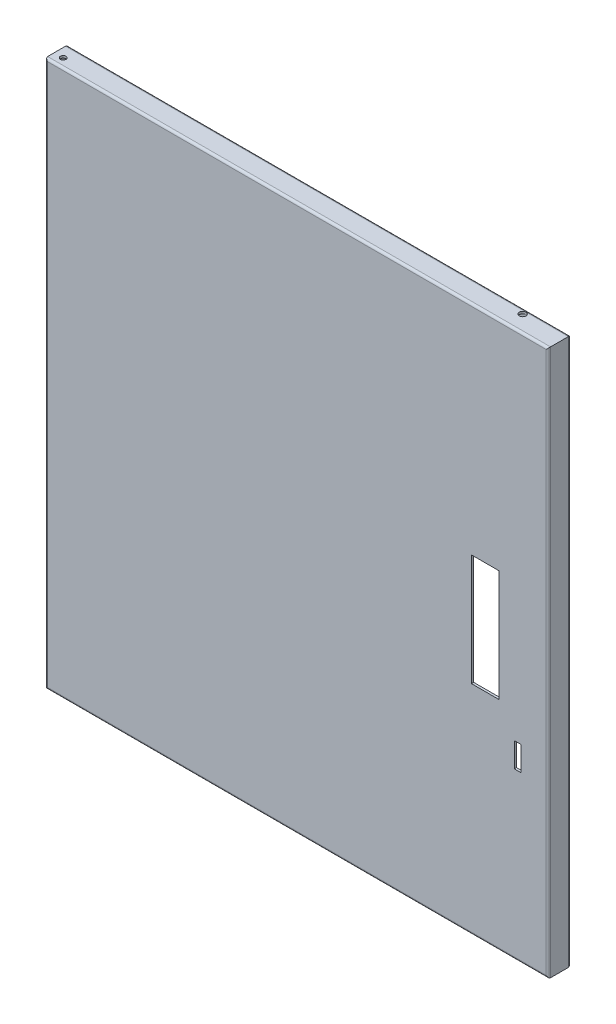
from build123d import *

# Parameters (mm, degrees)
SKETCH1_W           = 451
SKETCH1_H           = 490
BOSS_EXTRUDE1_DEPTH = 20
SKETCH2_W           = 429
SKETCH2_H           = 468
CUT_EXTRUDE1_DEPTH  = 18
SKETCH3_W           = 16
SKETCH3_H           = 468
CUT_EXTRUDE2_DEPTH  = 9
SKETCH4_W           = 438
SKETCH4_H           = 16
CUT_EXTRUDE3_DEPTH  = 9
SKETCH5_W           = 16
SKETCH5_H           = 477
CUT_EXTRUDE4_DEPTH  = 9
SKETCH6_W           = 447
SKETCH6_H           = 16
CUT_EXTRUDE5_DEPTH  = 9
FILLET3_R           = 2
FILLET4_R           = 2
SKETCH20_R          = 2.5
CUT_EXTRUDE12_DEPTH = 540.768700463
SKETCH21_R          = 3
CUT_EXTRUDE13_DEPTH = 2
SKETCH22_R          = 3
CUT_EXTRUDE14_DEPTH = 2
SKETCH23_W          = 25
SKETCH23_H          = 100
SKETCH23_W_2        = 6
SKETCH23_H_2        = 22
CUT_EXTRUDE15_DEPTH = 2


with BuildPart() as part:
    # Sketch1 → Boss-Extrude1 (new body)
    with BuildSketch(Plane.XY):
        Rectangle(SKETCH1_W, SKETCH1_H)
    extrude(amount=BOSS_EXTRUDE1_DEPTH)

    # Sketch2 → Cut-Extrude1 (cut)
    with BuildSketch(Plane(origin=(0, 0, 0), x_dir=(-1, 0, 0), z_dir=(0, 0, -1))):
        Rectangle(SKETCH2_W, SKETCH2_H)
    extrude(amount=-CUT_EXTRUDE1_DEPTH, mode=Mode.SUBTRACT)

    # Sketch3 → Cut-Extrude2 (cut)
    with BuildSketch(Plane(origin=(-214.5, 0, 0), x_dir=(0, 0, -1), z_dir=(1, 0, 0))):
        with Locations((-10, 0)):
            Rectangle(SKETCH3_W, SKETCH3_H)
    extrude(amount=-CUT_EXTRUDE2_DEPTH, mode=Mode.SUBTRACT)

    # Sketch4 → Cut-Extrude3 (cut)
    with BuildSketch(Plane(origin=(0, -234, 0), x_dir=(1, 0, 0), z_dir=(0, 1, 0))):
        with Locations((-4.5, -10)):
            Rectangle(SKETCH4_W, SKETCH4_H)
    extrude(amount=-CUT_EXTRUDE3_DEPTH, mode=Mode.SUBTRACT)

    # Sketch5 → Cut-Extrude4 (cut)
    with BuildSketch(Plane.ZY.offset(-214.5)):
        with Locations((10, -4.5)):
            Rectangle(SKETCH5_W, SKETCH5_H)
    extrude(amount=-CUT_EXTRUDE4_DEPTH, mode=Mode.SUBTRACT)

    # Sketch6 → Cut-Extrude5 (cut)
    with BuildSketch(Plane.XZ.offset(-234)):
        with Locations((0, 10)):
            Rectangle(SKETCH6_W, SKETCH6_H)
    extrude(amount=-CUT_EXTRUDE5_DEPTH, mode=Mode.SUBTRACT)

    # Fillet3
    fillet3_edges = [part.edges().sort_by_distance(p)[0] for p in [
        (214.5, 0, 0),
        (225.5, 0, 0),
        (0, 245, 0),
        (0, -245, 0),
        (-225.5, 0, 0),
        (-225.5, 0, 20),
        (0, -245, 20),
        (225.5, 0, 20),
        (0, 245, 20),
    ]]
    fillet(fillet3_edges, radius=FILLET3_R - 0.0001)  # a hair under: the kernel refuses the full size

    # Fillet4
    fillet4_edges = [part.edges().sort_by_distance(p)[0] for p in [
        (0, -243, 18),
        (223.5, 0, 18),
        (0, 243, 18),
        (-223.5, 0, 18),
        (-214.5, 0, 0),
        (0.99995, -234, 0),
        (0.99995, 234, 0),
    ]]
    fillet(fillet4_edges, radius=FILLET4_R - 0.0001)  # a hair under: the kernel refuses the full size

    # Sketch20 → Cut-Extrude12 (cut, through all)
    with BuildSketch(Plane(origin=(0, 245, 0), x_dir=(1, 0, 0), z_dir=(0, 1, 0))):
        with Locations(Location((-217.5, -12, 0), (0, 0, 270))):
            Circle(SKETCH20_R)
    extrude(amount=-CUT_EXTRUDE12_DEPTH, mode=Mode.SUBTRACT)

    # Sketch21 → Cut-Extrude13 (cut)
    with BuildSketch(Plane(origin=(0, 245, 0), x_dir=(1, 0, 0), z_dir=(0, 1, 0))):
        with Locations(Location((187.5, -5, 0), (0, 0, 90))):
            Circle(SKETCH21_R)
    extrude(amount=-CUT_EXTRUDE13_DEPTH, mode=Mode.SUBTRACT)

    # Sketch22 → Cut-Extrude14 (cut)
    with BuildSketch(Plane.XZ.offset(245)):
        with Locations(Location((150.5, 5, 0), (0, 0, 270))):
            Circle(SKETCH22_R)
    extrude(amount=-CUT_EXTRUDE14_DEPTH, mode=Mode.SUBTRACT)

    # Sketch23 → Cut-Extrude15 (cut)
    with BuildSketch(Plane.XY.offset(20)):
        with Locations((169, 0)):
            Rectangle(SKETCH23_W, SKETCH23_H)
        with Locations((198, -86)):
            Rectangle(SKETCH23_W_2, SKETCH23_H_2)
    extrude(amount=-CUT_EXTRUDE15_DEPTH, mode=Mode.SUBTRACT)


solid = part.part
